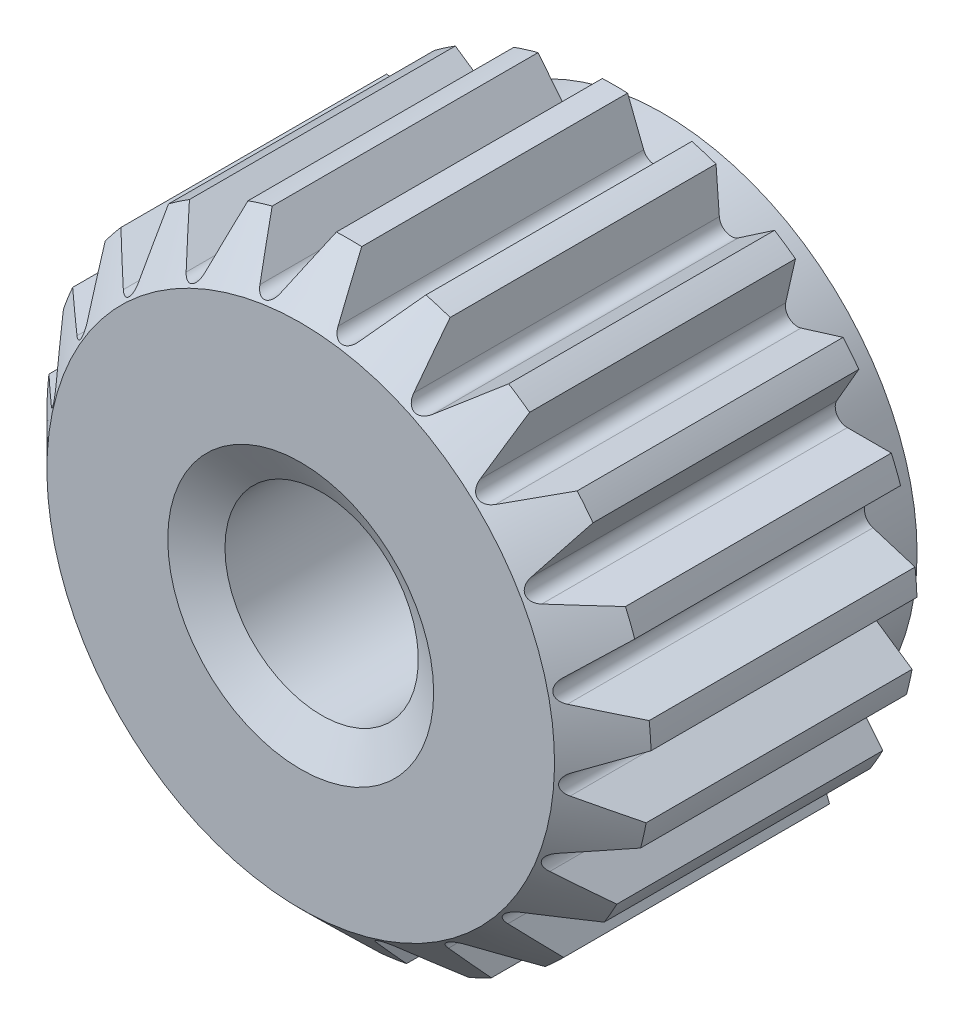
from build123d import *

# Parameters (mm, degrees)
OUTPUT_EXTRACTION_ENVELOPE_START = -3
SKETCH1_R                        = 2.6
OUTPUT_EXTRACTION_ENVELOPE_DEPTH = 3
OFFICIAL_OUTPUT_ONLY_START       = -3
OFFICIAL_OUTPUT_ONLY_OUTLINE_R   = 2.6
OFFICIAL_OUTPUT_ONLY_OUTLINE_R_2 = 0.8
OFFICIAL_OUTPUT_ONLY_DEPTH       = 3
OFFICIAL_OUTPUT_ONLY_2_OUTLINE_R = 2.1
OFFICIAL_OUTPUT_ONLY_2_DEPTH     = 0.4


with BuildPart() as part:
    # Sketch1 → Output_Extraction_Envelope (new body)
    with BuildSketch(Plane.XY.offset(OUTPUT_EXTRACTION_ENVELOPE_START)):
        Circle(SKETCH1_R)
    extrude(amount=OUTPUT_EXTRACTION_ENVELOPE_DEPTH)

    # Official_Output_Only: read off the stored shape, not the designer's step
    # Official_Output_Only outline → Official_Output_Only (cut)
    # profile 1 of 2: a face of its own
    with BuildSketch(Plane.XY.offset(OFFICIAL_OUTPUT_ONLY_START)):
        Circle(OFFICIAL_OUTPUT_ONLY_OUTLINE_R)
        with BuildLine():
            Line((-2.170404056, -0.075803921), (-2.498645994, 0.082269065))
            ThreePointArc((-2.498645994, 0.082269065), (-2.493009493, 0.186825234), (-2.48299975, 0.291053674))
            Line((-2.48299975, 0.291053674), (-2.134864448, 0.398439193))
            ThreePointArc((-2.134864448, 0.398439193), (-2.066847174, 0.47174438), (-2.096322691, 0.567301661))
            Line((-2.096322691, 0.567301661), (-2.36338893, 0.815102917))
            ThreePointArc((-2.36338893, 0.815102917), (-2.327184372, 0.913352561), (-2.286897462, 1.01))
            Line((-2.286897462, 1.01), (-1.922576396, 1.01))
            ThreePointArc((-1.922576396, 1.01), (-1.835973856, 1.06), (-1.835973856, 1.16))
            Line((-1.835973856, 1.16), (-2.018134389, 1.475511298))
            ThreePointArc((-2.018134389, 1.475511298), (-1.954578706, 1.558724505), (-1.887594298, 1.639203394))
            Line((-1.887594298, 1.639203394), (-1.539458995, 1.531817875))
            ThreePointArc((-1.539458995, 1.531817875), (-1.441966204, 1.554069968), (-1.412490687, 1.649627249))
            Line((-1.412490687, 1.649627249), (-1.49355975, 2.004814024))
            ThreePointArc((-1.49355975, 2.004814024), (-1.408300145, 2.065596936), (-1.320570097, 2.122756373))
            Line((-1.320570097, 2.122756373), (-1.019553907, 1.917527009))
            ThreePointArc((-1.019553907, 1.917527009), (-0.919833527, 1.910054), (-0.863501521, 1.992677877))
            Line((-0.863501521, 1.992677877), (-0.836275774, 2.355980227))
            ThreePointArc((-0.836275774, 2.355980227), (-0.736887936, 2.388932014), (-0.636207448, 2.417693133))
            Line((-0.636207448, 2.417693133), (-0.409056979, 2.132855454))
            ThreePointArc((-0.409056979, 2.132855454), (-0.315969604, 2.096321352), (-0.237786456, 2.158670332))
            Line((-0.237786456, 2.158670332), (-0.104685025, 2.497807247))
            ThreePointArc((-0.104685025, 2.497807247), (0, 2.5), (0.104685025, 2.497807247))
            Line((0.104685025, 2.497807247), (0.237786456, 2.158670332))
            ThreePointArc((0.237786456, 2.158670332), (0.315969604, 2.096321352), (0.409056979, 2.132855454))
            Line((0.409056979, 2.132855454), (0.636207448, 2.417693133))
            ThreePointArc((0.636207448, 2.417693133), (0.736887936, 2.388932014), (0.836275774, 2.355980227))
            Line((0.836275774, 2.355980227), (0.863501521, 1.992677877))
            ThreePointArc((0.863501521, 1.992677877), (0.919833527, 1.910054), (1.019553907, 1.917527009))
            Line((1.019553907, 1.917527009), (1.320570097, 2.122756373))
            ThreePointArc((1.320570097, 2.122756373), (1.408300145, 2.065596936), (1.49355975, 2.004814024))
            Line((1.49355975, 2.004814024), (1.412490687, 1.649627249))
            ThreePointArc((1.412490687, 1.649627249), (1.441966204, 1.554069968), (1.539458995, 1.531817875))
            Line((1.539458995, 1.531817875), (1.887594298, 1.639203394))
            ThreePointArc((1.887594298, 1.639203394), (1.954578706, 1.558724505), (2.018134389, 1.475511298))
            Line((2.018134389, 1.475511298), (1.835973856, 1.16))
            ThreePointArc((1.835973856, 1.16), (1.835973856, 1.06), (1.922576396, 1.01))
            Line((1.922576396, 1.01), (2.286897462, 1.01))
            ThreePointArc((2.286897462, 1.01), (2.327184372, 0.913352561), (2.36338893, 0.815102917))
            Line((2.36338893, 0.815102917), (2.096322691, 0.567301661))
            ThreePointArc((2.096322691, 0.567301661), (2.066847174, 0.47174438), (2.134864448, 0.398439193))
            Line((2.134864448, 0.398439193), (2.48299975, 0.291053674))
            ThreePointArc((2.48299975, 0.291053674), (2.493009493, 0.186825234), (2.498645994, 0.082269065))
            Line((2.498645994, 0.082269065), (2.170404056, -0.075803921))
            ThreePointArc((2.170404056, -0.075803921), (2.11407205, -0.158427798), (2.157460424, -0.248524685))
            Line((2.157460424, -0.248524685), (2.458476614, -0.453754049))
            ThreePointArc((2.458476614, -0.453754049), (2.43731978, -0.556302335), (2.411887395, -0.657874754))
            Line((2.411887395, -0.657874754), (2.051635495, -0.712173991))
            ThreePointArc((2.051635495, -0.712173991), (1.973452347, -0.774522972), (1.988356574, -0.873406054))
            Line((1.988356574, -0.873406054), (2.215507043, -1.158243733))
            ThreePointArc((2.215507043, -1.158243733), (2.165063509, -1.25), (2.110822018, -1.339563515))
            Line((2.110822018, -1.339563515), (1.750570118, -1.285264278))
            ThreePointArc((1.750570118, -1.285264278), (1.657482743, -1.32179838), (1.642578516, -1.420681463))
            Line((1.642578516, -1.420681463), (1.775679947, -1.759818378))
            ThreePointArc((1.775679947, -1.759818378), (1.700431845, -1.832629679), (1.622200841, -1.902226178))
            Line((1.622200841, -1.902226178), (1.293958903, -1.744153192))
            ThreePointArc((1.293958903, -1.744153192), (1.194238523, -1.751626202), (1.150850149, -1.841723088))
            Line((1.150850149, -1.841723088), (1.178075896, -2.205025438))
            ThreePointArc((1.178075896, -2.205025438), (1.084709348, -2.25242217), (0.98944, -2.295867698))
            Line((0.98944, -2.295867698), (0.722373761, -2.048066442))
            ThreePointArc((0.722373761, -2.048066442), (0.62488097, -2.025814348), (0.556863696, -2.099119535))
            Line((0.556863696, -2.099119535), (0.475794632, -2.454306311))
            ThreePointArc((0.475794632, -2.454306311), (0.372605665, -2.472077066), (0.268763073, -2.485511298))
            Line((0.268763073, -2.485511298), (0.08660254, -2.17))
            ThreePointArc((0.08660254, -2.17), (0, -2.12), (-0.08660254, -2.17))
            Line((-0.08660254, -2.17), (-0.268763073, -2.485511298))
            ThreePointArc((-0.268763073, -2.485511298), (-0.372605665, -2.472077066), (-0.475794632, -2.454306311))
            Line((-0.475794632, -2.454306311), (-0.556863696, -2.099119535))
            ThreePointArc((-0.556863696, -2.099119535), (-0.62488097, -2.025814348), (-0.722373761, -2.048066442))
            Line((-0.722373761, -2.048066442), (-0.98944, -2.295867698))
            ThreePointArc((-0.98944, -2.295867698), (-1.084709348, -2.25242217), (-1.178075896, -2.205025438))
            Line((-1.178075896, -2.205025438), (-1.150850149, -1.841723088))
            ThreePointArc((-1.150850149, -1.841723088), (-1.194238523, -1.751626202), (-1.293958903, -1.744153192))
            Line((-1.293958903, -1.744153192), (-1.622200841, -1.902226178))
            ThreePointArc((-1.622200841, -1.902226178), (-1.700431845, -1.832629679), (-1.775679947, -1.759818378))
            Line((-1.775679947, -1.759818378), (-1.642578516, -1.420681463))
            ThreePointArc((-1.642578516, -1.420681463), (-1.657482743, -1.32179838), (-1.750570118, -1.285264278))
            Line((-1.750570118, -1.285264278), (-2.110822018, -1.339563515))
            ThreePointArc((-2.110822018, -1.339563515), (-2.165063509, -1.25), (-2.215507043, -1.158243733))
            Line((-2.215507043, -1.158243733), (-1.988356574, -0.873406054))
            ThreePointArc((-1.988356574, -0.873406054), (-1.973452347, -0.774522972), (-2.051635495, -0.712173991))
            Line((-2.051635495, -0.712173991), (-2.411887395, -0.657874754))
            ThreePointArc((-2.411887395, -0.657874754), (-2.43731978, -0.556302335), (-2.458476614, -0.453754049))
            Line((-2.458476614, -0.453754049), (-2.157460424, -0.248524685))
            ThreePointArc((-2.157460424, -0.248524685), (-2.11407205, -0.158427798), (-2.170404056, -0.075803921))
        make_face(mode=Mode.SUBTRACT)
    # profile 2 of 2: a face of its own
    with BuildSketch(Plane.XY.offset(OFFICIAL_OUTPUT_ONLY_START)):
        Circle(OFFICIAL_OUTPUT_ONLY_OUTLINE_R_2)
    extrude(amount=OFFICIAL_OUTPUT_ONLY_DEPTH, mode=Mode.SUBTRACT)

    # Official_Output_Only 2 outline → Official_Output_Only 2 (cut)
    with BuildSketch(Plane.XY.offset(OFFICIAL_OUTPUT_ONLY_START)):
        with BuildLine():
            ThreePointArc((-2.48299975, 0.291053674), (-2.493009493, 0.186825234), (-2.498645994, 0.082269065))
            Line((-2.498645994, 0.082269065), (-2.170404056, -0.075803921))
            ThreePointArc((-2.170404056, -0.075803921), (-2.11407205, -0.158427798), (-2.157460424, -0.248524685))
            Line((-2.157460424, -0.248524685), (-2.458476614, -0.453754049))
            ThreePointArc((-2.458476614, -0.453754049), (-2.43731978, -0.556302335), (-2.411887395, -0.657874754))
            Line((-2.411887395, -0.657874754), (-2.051635495, -0.712173991))
            ThreePointArc((-2.051635495, -0.712173991), (-1.973452347, -0.774522972), (-1.988356574, -0.873406054))
            Line((-1.988356574, -0.873406054), (-2.215507043, -1.158243733))
            ThreePointArc((-2.215507043, -1.158243733), (-2.165063509, -1.25), (-2.110822018, -1.339563515))
            Line((-2.110822018, -1.339563515), (-1.750570118, -1.285264278))
            ThreePointArc((-1.750570118, -1.285264278), (-1.657482743, -1.32179838), (-1.642578516, -1.420681463))
            Line((-1.642578516, -1.420681463), (-1.775679947, -1.759818378))
            ThreePointArc((-1.775679947, -1.759818378), (-1.700431845, -1.832629679), (-1.622200841, -1.902226178))
            Line((-1.622200841, -1.902226178), (-1.293958903, -1.744153192))
            ThreePointArc((-1.293958903, -1.744153192), (-1.194238523, -1.751626202), (-1.150850149, -1.841723088))
            Line((-1.150850149, -1.841723088), (-1.178075896, -2.205025438))
            ThreePointArc((-1.178075896, -2.205025438), (-1.084709348, -2.25242217), (-0.98944, -2.295867698))
            Line((-0.98944, -2.295867698), (-0.722373761, -2.048066442))
            ThreePointArc((-0.722373761, -2.048066442), (-0.62488097, -2.025814348), (-0.556863696, -2.099119535))
            Line((-0.556863696, -2.099119535), (-0.475794632, -2.454306311))
            ThreePointArc((-0.475794632, -2.454306311), (-0.372605665, -2.472077066), (-0.268763073, -2.485511298))
            Line((-0.268763073, -2.485511298), (-0.08660254, -2.17))
            ThreePointArc((-0.08660254, -2.17), (0, -2.12), (0.08660254, -2.17))
            Line((0.08660254, -2.17), (0.268763073, -2.485511298))
            ThreePointArc((0.268763073, -2.485511298), (0.372605665, -2.472077066), (0.475794632, -2.454306311))
            Line((0.475794632, -2.454306311), (0.556863696, -2.099119535))
            ThreePointArc((0.556863696, -2.099119535), (0.62488097, -2.025814348), (0.722373761, -2.048066442))
            Line((0.722373761, -2.048066442), (0.98944, -2.295867698))
            ThreePointArc((0.98944, -2.295867698), (1.084709348, -2.25242217), (1.178075896, -2.205025438))
            Line((1.178075896, -2.205025438), (1.150850149, -1.841723088))
            ThreePointArc((1.150850149, -1.841723088), (1.194238523, -1.751626202), (1.293958903, -1.744153192))
            Line((1.293958903, -1.744153192), (1.622200841, -1.902226178))
            ThreePointArc((1.622200841, -1.902226178), (1.700431845, -1.832629679), (1.775679947, -1.759818378))
            Line((1.775679947, -1.759818378), (1.642578516, -1.420681463))
            ThreePointArc((1.642578516, -1.420681463), (1.657482743, -1.32179838), (1.750570118, -1.285264278))
            Line((1.750570118, -1.285264278), (2.110822018, -1.339563515))
            ThreePointArc((2.110822018, -1.339563515), (2.165063509, -1.25), (2.215507043, -1.158243733))
            Line((2.215507043, -1.158243733), (1.988356574, -0.873406054))
            ThreePointArc((1.988356574, -0.873406054), (1.973452347, -0.774522972), (2.051635495, -0.712173991))
            Line((2.051635495, -0.712173991), (2.411887395, -0.657874754))
            ThreePointArc((2.411887395, -0.657874754), (2.43731978, -0.556302335), (2.458476614, -0.453754049))
            Line((2.458476614, -0.453754049), (2.157460424, -0.248524685))
            ThreePointArc((2.157460424, -0.248524685), (2.11407205, -0.158427798), (2.170404056, -0.075803921))
            Line((2.170404056, -0.075803921), (2.498645994, 0.082269065))
            ThreePointArc((2.498645994, 0.082269065), (2.493009493, 0.186825234), (2.48299975, 0.291053674))
            Line((2.48299975, 0.291053674), (2.134864448, 0.398439193))
            ThreePointArc((2.134864448, 0.398439193), (2.066847174, 0.47174438), (2.096322691, 0.567301661))
            Line((2.096322691, 0.567301661), (2.36338893, 0.815102917))
            ThreePointArc((2.36338893, 0.815102917), (2.327184372, 0.913352561), (2.286897462, 1.01))
            Line((2.286897462, 1.01), (1.922576396, 1.01))
            ThreePointArc((1.922576396, 1.01), (1.835973856, 1.06), (1.835973856, 1.16))
            Line((1.835973856, 1.16), (2.018134389, 1.475511298))
            ThreePointArc((2.018134389, 1.475511298), (1.954578706, 1.558724505), (1.887594298, 1.639203394))
            Line((1.887594298, 1.639203394), (1.539458995, 1.531817875))
            ThreePointArc((1.539458995, 1.531817875), (1.441966204, 1.554069968), (1.412490687, 1.649627249))
            Line((1.412490687, 1.649627249), (1.49355975, 2.004814024))
            ThreePointArc((1.49355975, 2.004814024), (1.408300145, 2.065596936), (1.320570097, 2.122756373))
            Line((1.320570097, 2.122756373), (1.019553907, 1.917527009))
            ThreePointArc((1.019553907, 1.917527009), (0.919833527, 1.910054), (0.863501521, 1.992677877))
            Line((0.863501521, 1.992677877), (0.836275774, 2.355980227))
            ThreePointArc((0.836275774, 2.355980227), (0.736887936, 2.388932014), (0.636207448, 2.417693133))
            Line((0.636207448, 2.417693133), (0.409056979, 2.132855454))
            ThreePointArc((0.409056979, 2.132855454), (0.315969604, 2.096321352), (0.237786456, 2.158670332))
            Line((0.237786456, 2.158670332), (0.104685025, 2.497807247))
            ThreePointArc((0.104685025, 2.497807247), (0, 2.5), (-0.104685025, 2.497807247))
            Line((-0.104685025, 2.497807247), (-0.237786456, 2.158670332))
            ThreePointArc((-0.237786456, 2.158670332), (-0.315969604, 2.096321352), (-0.409056979, 2.132855454))
            Line((-0.409056979, 2.132855454), (-0.636207448, 2.417693133))
            ThreePointArc((-0.636207448, 2.417693133), (-0.736887936, 2.388932014), (-0.836275774, 2.355980227))
            Line((-0.836275774, 2.355980227), (-0.863501521, 1.992677877))
            ThreePointArc((-0.863501521, 1.992677877), (-0.919833527, 1.910054), (-1.019553907, 1.917527009))
            Line((-1.019553907, 1.917527009), (-1.320570097, 2.122756373))
            ThreePointArc((-1.320570097, 2.122756373), (-1.408300145, 2.065596936), (-1.49355975, 2.004814024))
            Line((-1.49355975, 2.004814024), (-1.412490687, 1.649627249))
            ThreePointArc((-1.412490687, 1.649627249), (-1.441966204, 1.554069968), (-1.539458995, 1.531817875))
            Line((-1.539458995, 1.531817875), (-1.887594298, 1.639203394))
            ThreePointArc((-1.887594298, 1.639203394), (-1.954578706, 1.558724505), (-2.018134389, 1.475511298))
            Line((-2.018134389, 1.475511298), (-1.835973856, 1.16))
            ThreePointArc((-1.835973856, 1.16), (-1.835973856, 1.06), (-1.922576396, 1.01))
            Line((-1.922576396, 1.01), (-2.286897462, 1.01))
            ThreePointArc((-2.286897462, 1.01), (-2.327184372, 0.913352561), (-2.36338893, 0.815102917))
            Line((-2.36338893, 0.815102917), (-2.096322691, 0.567301661))
            ThreePointArc((-2.096322691, 0.567301661), (-2.066847174, 0.47174438), (-2.134864448, 0.398439193))
            Line((-2.134864448, 0.398439193), (-2.48299975, 0.291053674))
        make_face()
        Circle(OFFICIAL_OUTPUT_ONLY_2_OUTLINE_R, mode=Mode.SUBTRACT)
    extrude(amount=OFFICIAL_OUTPUT_ONLY_2_DEPTH, mode=Mode.SUBTRACT)

    # Official_Output_Only 3 outline → Official_Output_Only 3 (revolve, cut)
    with BuildSketch(Plane.XZ):
        Polygon((2.5, 0), (2.1, 0), (2.5, -0.4), align=None)
        Polygon((0.8, -0.173205081), (1.1, 0), (0.8, 0), align=None)
    revolve(axis=Axis((0, 0, 0), (0, 0, 1)), mode=Mode.SUBTRACT)


solid = part.part
